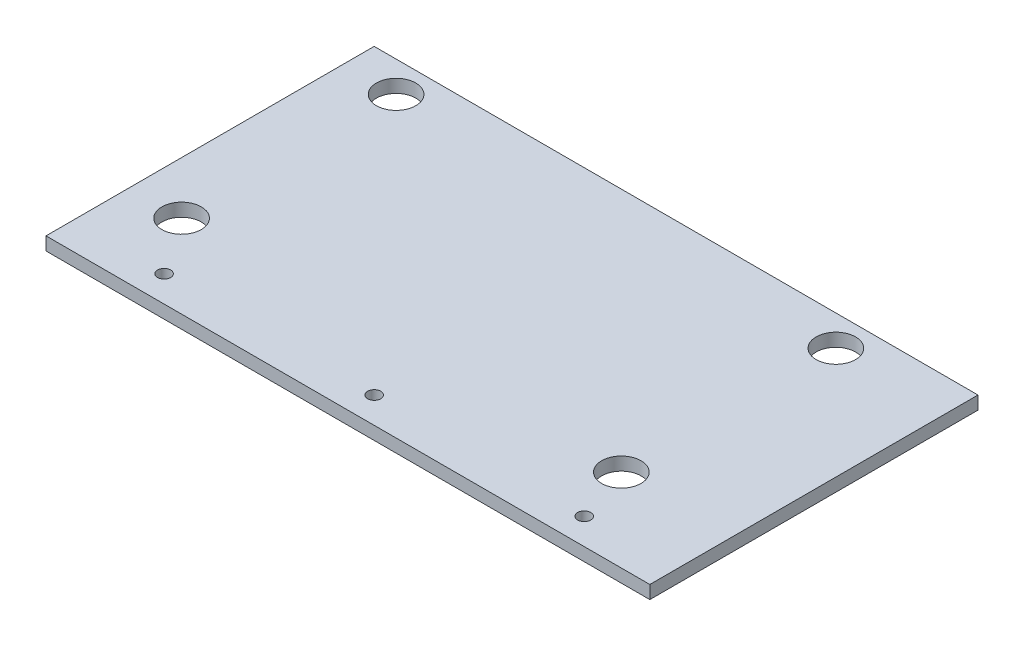
from build123d import *

# Parameters (mm, degrees)
SKETCH1_W           = 292.1
SKETCH1_H           = 158.75
BOSS_EXTRUDE1_DEPTH = 6.35
SKETCH2_R           = 3.175
CUT_EXTRUDE2_DEPTH  = 6.35
SKETCH6_R           = 9.525
CUT_EXTRUDE3_DEPTH  = 333.512097524


with BuildPart() as part:
    # Sketch1 → Boss-Extrude1 (new body)
    with BuildSketch(Plane(origin=(0, 0, 0), x_dir=(1, 0, 0), z_dir=(0, 1, 0))):
        with Locations((146.05, 79.375)):
            Rectangle(SKETCH1_W, SKETCH1_H)
    extrude(amount=BOSS_EXTRUDE1_DEPTH)

    # Sketch2 → Cut-Extrude2 (cut)
    with BuildSketch(Plane(origin=(0, 6.35, 0), x_dir=(1, 0, 0), z_dir=(0, 1, 0))):
        with Locations((146.05, 12.7)):
            Circle(SKETCH2_R)
        with Locations((247.65, 12.7)):
            Circle(SKETCH2_R)
        with Locations((44.45, 12.7)):
            Circle(SKETCH2_R)
    extrude(amount=-CUT_EXTRUDE2_DEPTH, mode=Mode.SUBTRACT)

    # Sketch6 → Cut-Extrude3 (cut, through all)
    with BuildSketch(Plane(origin=(0, 6.35, 0), x_dir=(1, 0, 0), z_dir=(0, 1, 0))):
        with Locations((25.4, 40.187936889)):
            Circle(SKETCH6_R)
        with Locations((238.125, 40.187936889)):
            Circle(SKETCH6_R)
        with Locations((25.4, 143.962063111)):
            Circle(SKETCH6_R)
        with Locations((238.125, 143.962063111)):
            Circle(SKETCH6_R)
    extrude(amount=-CUT_EXTRUDE3_DEPTH, mode=Mode.SUBTRACT)


solid = part.part
